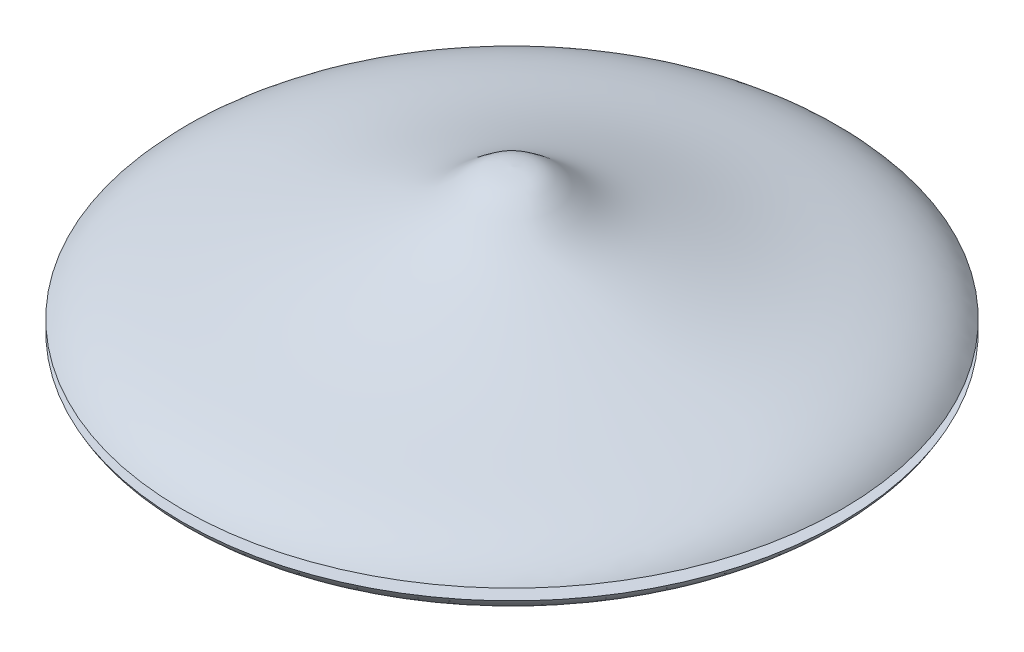
from build123d import *

# Parameters (mm, degrees)
SHELL_13_T                       = -2
SKETCH_2_W                       = 10
SKETCH_2_H                       = 3
CUT_EXTRUDE_1_DEPTH              = 271
FILLET_1_R                       = 1
PATTERN_CIRCULAR_1_COUNT         = 20
FILLET_1_OF_PATTERN_CIRCULAR_1_R = 1
EXTRUDE_1_DEPTH                  = 142
SPLIT_START                      = -4
SPLIT_BODIES_3_DEPTH             = 3
PATTERN_CIRCULAR_2_COUNT         = 20


# Read off the part's stored shape, not the designer's step: 旋转1, 分割2, 分割3
with BuildPart() as part:
    # 旋转1 outline → 旋转1 (revolve)
    with BuildSketch(Plane.XY):
        with BuildLine():
            Line((0, 60), (0, -70))
            add(Edge.make_bspline(
                [(0, -70), (0.779494045, -70.018102386), (1.54349499, -70.034544325), (27.223785899, -70.520838767), (35.812663986, -67.699015528), (45.753641527, -40.847751284), (58.842437547, -24.224144722), (91.788047688, -35.419293731), (143.768688707, -19.533365581), (150, -5)],
                knots=[0.970833987, 0.970833987, 0.970833987, 0.970833987, 0.970833987, 0.970833987, 0.970833987, 0.970833987, 1, 1, 1.970833987, 1.970833987, 1.970833987, 1.970833987, 1.970833987, 1.970833987, 1.970833987, 1.970833987], degree=7))
            Line((150, -5), (140, -5))
            Line((140, -5), (140, 0))
            Line((140, 0), (150, 0))
            add(Edge.make_bspline(
                [(150, 0), (148.947149417, 1.342934164), (147.822698998, 2.580635835), (146.635157273, 3.722835453), (119.131146596, 27.083441425), (67.999536491, 12.066729709), (63.14784772, 40.082237438), (35.985027936, 39.794313027), (30.060066805, 33.276969956), (16.583639754, 58.141927425), (17.538650575, 58.81401521), (0, 60)],
                knots=[0.954811349, 0.954811349, 0.954811349, 0.954811349, 0.954811349, 0.954811349, 0.954811349, 0.954811349, 0.954811349, 1, 1, 1, 1.954811349, 1.954811349, 1.954811349, 1.954811349, 1.954811349, 1.954811349, 1.954811349, 1.954811349, 1.954811349], degree=8))
        make_face()
    revolve(axis=Axis((0, 0, 0), (0, 1, 0)))


with BuildPart() as body_2:
    # Split Bodies 1: the piece on the far side of the plane
    add(part.part)
    split(bisect_by=Plane(origin=(0, 0, 0), x_dir=(-1, 0, 0), z_dir=(0, -1, 0)), keep=Keep.BOTTOM)


with BuildPart() as part_1:
    add(part.part)

    # Split Bodies 1
    split(bisect_by=Plane(origin=(0, 0, 0), x_dir=(-1, 0, 0), z_dir=(0, -1, 0)), keep=Keep.TOP)


with BuildPart() as body_3:
    # Split Bodies 2: the piece on the far side of the plane
    add(part_1.part)
    split(bisect_by=Plane(origin=(0, -5, 0), x_dir=(1, 0, 0), z_dir=(0, 1, 0)), keep=Keep.BOTTOM)


with BuildPart() as part_2:
    add(part_1.part)

    # Split Bodies 2
    split(bisect_by=Plane(origin=(0, -5, 0), x_dir=(1, 0, 0), z_dir=(0, 1, 0)), keep=Keep.TOP)

    # 抽壳13
    shell_13_openings = [part_2.faces().sort_by_distance(p)[0] for p in [
        (0, 0, 0),
        (0, -5, 0),
    ]]
    offset(amount=SHELL_13_T, openings=shell_13_openings, kind=Kind.INTERSECTION)

    # 草图2 → 切除-拉伸1 (cut)
    with BuildSketch(Plane.XY):
        with Locations((0, -2.5)):
            Rectangle(SKETCH_2_W, SKETCH_2_H)
    cut_extrude_1 = extrude(amount=CUT_EXTRUDE_1_DEPTH, mode=Mode.SUBTRACT)

    # 圆角1
    fillet_1_edges = [part_2.edges().sort_by_distance(p)[0] for p in [
        (5, -4, 138.91003817),
        (5, -1, 138.91003817),
        (-5, -1, 138.91003817),
        (-5, -4, 138.91003817),
    ]]
    fillet(fillet_1_edges, radius=FILLET_1_R)

    # 阵列(圆周)1: 切除-拉伸1 ×20 about axis
    pattern_circular_1_axis = Axis((0, 0, 0), (0, 1, 0))
    for i in range(1, PATTERN_CIRCULAR_1_COUNT):
        add(cut_extrude_1.rotate(pattern_circular_1_axis, i * 360 / PATTERN_CIRCULAR_1_COUNT), mode=Mode.SUBTRACT)

    # 圆角1 of 阵列(圆周)1
    fillet_1_of_pattern_circular_1_edges = [part_2.edges().sort_by_distance(p)[0] for p in [
        (47.680845065, -4, 130.566212008),
        (47.680845065, -1, 130.566212008),
        (38.170279902, -1, 133.656381952),
        (38.170279902, -4, 133.656381952),
        (85.694356803, -4, 109.441655307),
        (85.694356803, -1, 109.441655307),
        (77.60418686, -1, 115.31950783),
        (77.60418686, -4, 115.31950783),
        (115.31950783, -4, 77.60418686),
        (115.31950783, -1, 77.60418686),
        (109.441655307, -1, 85.694356803),
        (109.441655307, -4, 85.694356803),
        (133.656381952, -4, 38.170279902),
        (133.656381952, -1, 38.170279902),
        (130.566212008, -1, 47.680845065),
        (130.566212008, -4, 47.680845065),
        (138.91003817, -4, -5),
        (138.91003817, -1, -5),
        (138.91003817, -1, 5),
        (138.91003817, -4, 5),
        (130.566212008, -4, -47.680845065),
        (130.566212008, -1, -47.680845065),
        (133.656381952, -1, -38.170279902),
        (133.656381952, -4, -38.170279902),
        (109.441655307, -4, -85.694356803),
        (109.441655307, -1, -85.694356803),
        (115.31950783, -1, -77.60418686),
        (115.31950783, -4, -77.60418686),
        (77.60418686, -4, -115.31950783),
        (77.60418686, -1, -115.31950783),
        (85.694356803, -1, -109.441655307),
        (85.694356803, -4, -109.441655307),
        (38.170279902, -4, -133.656381952),
        (38.170279902, -1, -133.656381952),
        (47.680845065, -1, -130.566212008),
        (47.680845065, -4, -130.566212008),
        (-5, -4, -138.91003817),
        (-5, -1, -138.91003817),
        (5, -1, -138.91003817),
        (5, -4, -138.91003817),
        (-47.680845065, -4, -130.566212008),
        (-47.680845065, -1, -130.566212008),
        (-38.170279902, -1, -133.656381952),
        (-38.170279902, -4, -133.656381952),
        (-85.694356803, -4, -109.441655307),
        (-85.694356803, -1, -109.441655307),
        (-77.60418686, -1, -115.31950783),
        (-77.60418686, -4, -115.31950783),
        (-115.31950783, -4, -77.60418686),
        (-115.31950783, -1, -77.60418686),
        (-109.441655307, -1, -85.694356803),
        (-109.441655307, -4, -85.694356803),
        (-133.656381952, -4, -38.170279902),
        (-133.656381952, -1, -38.170279902),
        (-130.566212008, -1, -47.680845065),
        (-130.566212008, -4, -47.680845065),
        (-138.91003817, -4, 5),
        (-138.91003817, -1, 5),
        (-138.91003817, -1, -5),
        (-138.91003817, -4, -5),
        (-130.566212008, -4, 47.680845065),
        (-130.566212008, -1, 47.680845065),
        (-133.656381952, -1, 38.170279902),
        (-133.656381952, -4, 38.170279902),
        (-109.441655307, -4, 85.694356803),
        (-109.441655307, -1, 85.694356803),
        (-115.31950783, -1, 77.60418686),
        (-115.31950783, -4, 77.60418686),
        (-77.60418686, -4, 115.31950783),
        (-77.60418686, -1, 115.31950783),
        (-85.694356803, -1, 109.441655307),
        (-85.694356803, -4, 109.441655307),
        (-38.170279902, -4, 133.656381952),
        (-38.170279902, -1, 133.656381952),
        (-47.680845065, -1, 130.566212008),
        (-47.680845065, -4, 130.566212008),
    ]]
    fillet(fillet_1_of_pattern_circular_1_edges, radius=FILLET_1_OF_PATTERN_CIRCULAR_1_R)


with BuildPart() as body_4:
    # 草图3 → 凸台-拉伸1 (new body)
    with BuildSketch(Plane.XY):
        with BuildLine():
            Line((-4, -1), (4, -1))
            ThreePointArc((4, -1), (4.707106781, -1.292893219), (5, -2))
            Line((5, -2), (5, -3))
            ThreePointArc((5, -3), (4.707106781, -3.707106781), (4, -4))
            Line((4, -4), (-4, -4))
            ThreePointArc((-4, -4), (-4.707106781, -3.707106781), (-5, -3))
            Line((-5, -3), (-5, -2))
            ThreePointArc((-5, -2), (-4.707106781, -1.292893219), (-4, -1))
        make_face()
    extrude(amount=EXTRUDE_1_DEPTH)

    # Split Bodies 3 outline → Split Bodies 3 (cut)
    with BuildSketch(Plane(origin=(0, 0, 0), x_dir=(1, 0, 0), z_dir=(0, 1, 0)).offset(SPLIT_START)):
        with BuildLine():
            Line((-5, 0), (-5.000001503, -137.909390489))
            ThreePointArc((-5.000001503, -137.909390489), (0, -138), (5.000001503, -137.909390489))
            Line((5.000001503, -137.909390489), (5, 0))
            Line((5, 0), (-5, 0))
        make_face()
    extrude(amount=SPLIT_BODIES_3_DEPTH, mode=Mode.SUBTRACT)


with BuildPart() as pattern_circular_2_1:
    # 阵列(圆周)2: pattern copy
    add(body_4.part.rotate(Axis((0, 0, 0), (0, 1, 0)), 1 * 360 / PATTERN_CIRCULAR_2_COUNT))


with BuildPart() as pattern_circular_2_2:
    # 阵列(圆周)2: pattern copy
    add(body_4.part.rotate(Axis((0, 0, 0), (0, 1, 0)), 2 * 360 / PATTERN_CIRCULAR_2_COUNT))


with BuildPart() as pattern_circular_2_3:
    # 阵列(圆周)2: pattern copy
    add(body_4.part.rotate(Axis((0, 0, 0), (0, 1, 0)), 3 * 360 / PATTERN_CIRCULAR_2_COUNT))


with BuildPart() as pattern_circular_2_4:
    # 阵列(圆周)2: pattern copy
    add(body_4.part.rotate(Axis((0, 0, 0), (0, 1, 0)), 4 * 360 / PATTERN_CIRCULAR_2_COUNT))


with BuildPart() as pattern_circular_2_5:
    # 阵列(圆周)2: pattern copy
    add(body_4.part.rotate(Axis((0, 0, 0), (0, 1, 0)), 5 * 360 / PATTERN_CIRCULAR_2_COUNT))


with BuildPart() as pattern_circular_2_6:
    # 阵列(圆周)2: pattern copy
    add(body_4.part.rotate(Axis((0, 0, 0), (0, 1, 0)), 6 * 360 / PATTERN_CIRCULAR_2_COUNT))


with BuildPart() as pattern_circular_2_7:
    # 阵列(圆周)2: pattern copy
    add(body_4.part.rotate(Axis((0, 0, 0), (0, 1, 0)), 7 * 360 / PATTERN_CIRCULAR_2_COUNT))


with BuildPart() as pattern_circular_2_8:
    # 阵列(圆周)2: pattern copy
    add(body_4.part.rotate(Axis((0, 0, 0), (0, 1, 0)), 8 * 360 / PATTERN_CIRCULAR_2_COUNT))


with BuildPart() as pattern_circular_2_9:
    # 阵列(圆周)2: pattern copy
    add(body_4.part.rotate(Axis((0, 0, 0), (0, 1, 0)), 9 * 360 / PATTERN_CIRCULAR_2_COUNT))


with BuildPart() as pattern_circular_2_10:
    # 阵列(圆周)2: pattern copy
    add(body_4.part.rotate(Axis((0, 0, 0), (0, 1, 0)), 10 * 360 / PATTERN_CIRCULAR_2_COUNT))


with BuildPart() as pattern_circular_2_11:
    # 阵列(圆周)2: pattern copy
    add(body_4.part.rotate(Axis((0, 0, 0), (0, 1, 0)), 11 * 360 / PATTERN_CIRCULAR_2_COUNT))


with BuildPart() as pattern_circular_2_12:
    # 阵列(圆周)2: pattern copy
    add(body_4.part.rotate(Axis((0, 0, 0), (0, 1, 0)), 12 * 360 / PATTERN_CIRCULAR_2_COUNT))


with BuildPart() as pattern_circular_2_13:
    # 阵列(圆周)2: pattern copy
    add(body_4.part.rotate(Axis((0, 0, 0), (0, 1, 0)), 13 * 360 / PATTERN_CIRCULAR_2_COUNT))


with BuildPart() as pattern_circular_2_14:
    # 阵列(圆周)2: pattern copy
    add(body_4.part.rotate(Axis((0, 0, 0), (0, 1, 0)), 14 * 360 / PATTERN_CIRCULAR_2_COUNT))


with BuildPart() as pattern_circular_2_15:
    # 阵列(圆周)2: pattern copy
    add(body_4.part.rotate(Axis((0, 0, 0), (0, 1, 0)), 15 * 360 / PATTERN_CIRCULAR_2_COUNT))


with BuildPart() as pattern_circular_2_16:
    # 阵列(圆周)2: pattern copy
    add(body_4.part.rotate(Axis((0, 0, 0), (0, 1, 0)), 16 * 360 / PATTERN_CIRCULAR_2_COUNT))


with BuildPart() as pattern_circular_2_17:
    # 阵列(圆周)2: pattern copy
    add(body_4.part.rotate(Axis((0, 0, 0), (0, 1, 0)), 17 * 360 / PATTERN_CIRCULAR_2_COUNT))


with BuildPart() as pattern_circular_2_18:
    # 阵列(圆周)2: pattern copy
    add(body_4.part.rotate(Axis((0, 0, 0), (0, 1, 0)), 18 * 360 / PATTERN_CIRCULAR_2_COUNT))


with BuildPart() as pattern_circular_2_19:
    # 阵列(圆周)2: pattern copy
    add(body_4.part.rotate(Axis((0, 0, 0), (0, 1, 0)), 19 * 360 / PATTERN_CIRCULAR_2_COUNT))


solid = Compound([body_2.part, body_3.part, part_2.part, body_4.part, pattern_circular_2_1.part, pattern_circular_2_2.part, pattern_circular_2_3.part, pattern_circular_2_4.part, pattern_circular_2_5.part, pattern_circular_2_6.part, pattern_circular_2_7.part, pattern_circular_2_8.part, pattern_circular_2_9.part, pattern_circular_2_10.part, pattern_circular_2_11.part, pattern_circular_2_12.part, pattern_circular_2_13.part, pattern_circular_2_14.part, pattern_circular_2_15.part, pattern_circular_2_16.part, pattern_circular_2_17.part, pattern_circular_2_18.part, pattern_circular_2_19.part])
